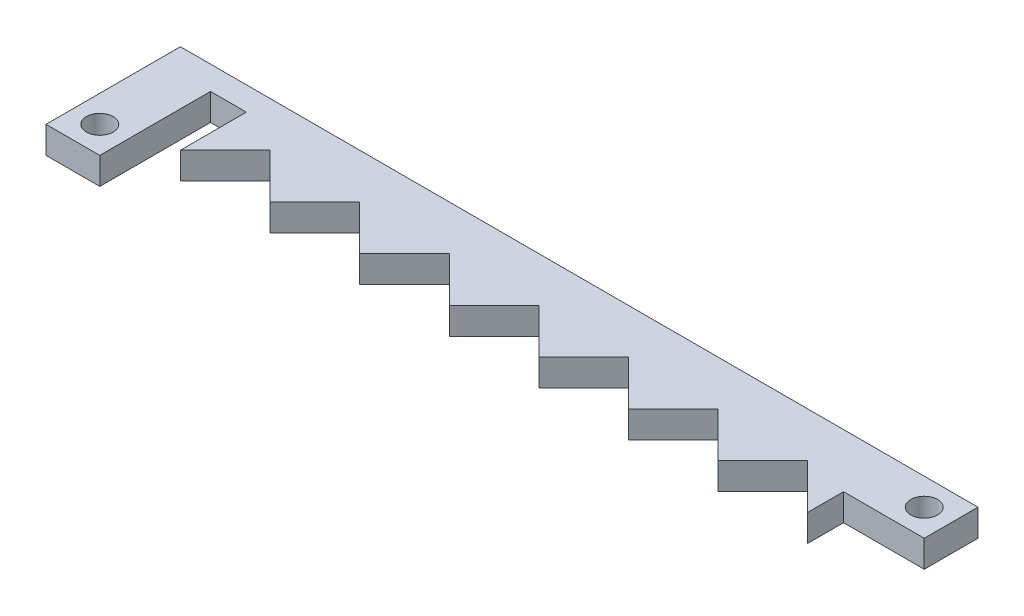
from build123d import *

# Parameters (mm, degrees)
SKETCH1_R           = 1.5
BOSS_EXTRUDE1_DEPTH = 3


with BuildPart() as part:
    # Sketch1 → Boss-Extrude1 (new body)
    with BuildSketch(Plane(origin=(0, 0, 0), x_dir=(1, 0, 0), z_dir=(0, 1, 0))):
        Polygon((0, 42.341154582), (0, 38.341154582), (5, 43.341154582), (10, 38.341154582), (15, 43.341154582), (20, 38.341154582), (25, 43.341154582), (30, 38.341154582), (35, 43.341154582), (40, 38.341154582), (45, 43.341154582), (50, 38.341154582), (55, 43.341154582), (60, 38.341154582), (65, 43.341154582), (70, 38.341154582), (70, 42.341154582), (79, 42.341154582), (79, 48.341154582), (70, 48.341154582), (5, 48.341154582), (0, 48.341154582), (-10, 48.341154582), (-10, 33.341154582), (-4, 33.341154582), (-4, 45.696811654), (0, 45.696811654), align=None)
        with Locations((-7, 36.341154582)):
            Circle(SKETCH1_R, mode=Mode.SUBTRACT)
        with Locations((76, 45.341154582)):
            Circle(SKETCH1_R, mode=Mode.SUBTRACT)
    extrude(amount=BOSS_EXTRUDE1_DEPTH)


solid = part.part
